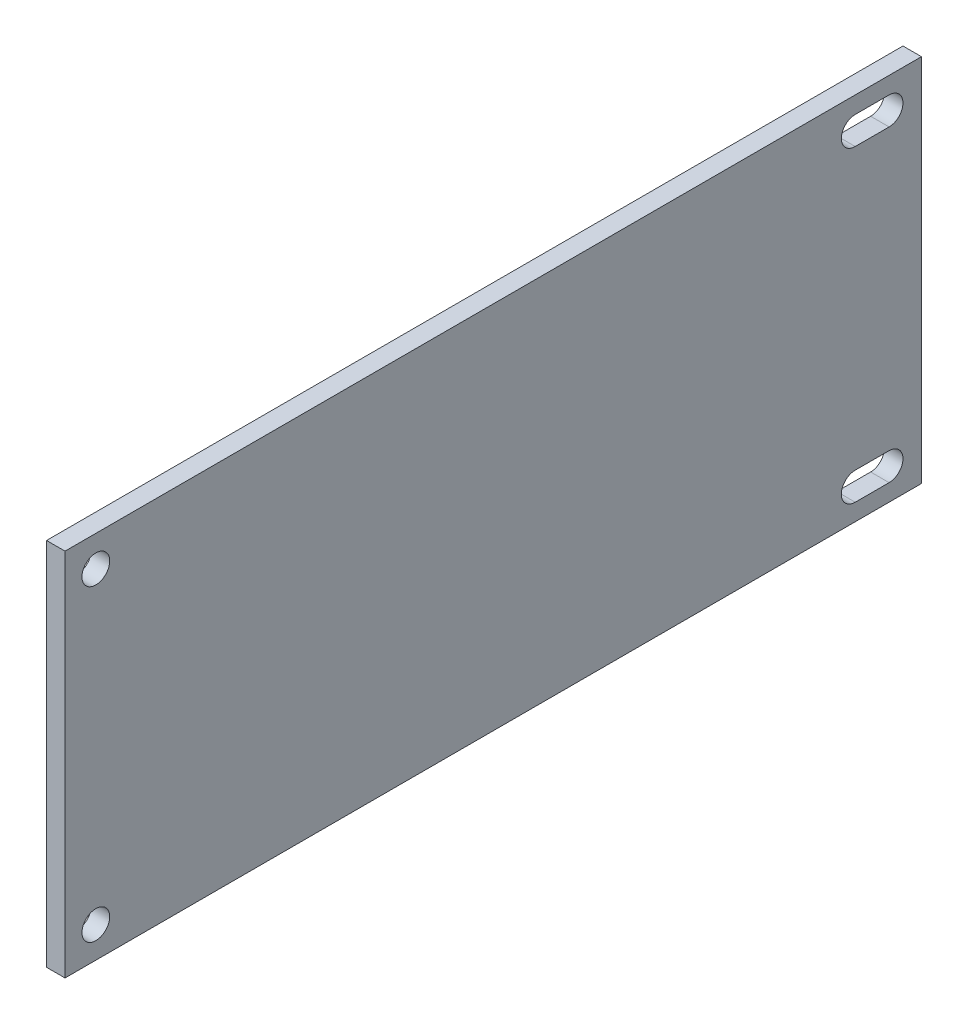
from build123d import *

# Parameters (mm, degrees)
SKETCH_1_W               = 139
SKETCH_1_H               = 60
EXTRUDE_1_DEPTH          = 1.5
HOLE_WIZARD_M4_1_D       = 4.5
HOLE_START               = -1.5
HOLE_WIZARD_M4_1_2_DEPTH = 3


# Read off the part's stored shape, not the designer's step: M4 间隙槽口1
with BuildPart() as part:
    # 草图1 → 凸台-拉伸1 (new, symmetric)
    with BuildSketch(Plane(origin=(0, 0, 0), x_dir=(0, 0, -1), z_dir=(1, 0, 0))):
        with Locations((69.5, 30)):
            Rectangle(SKETCH_1_W, SKETCH_1_H)
    extrude(amount=EXTRUDE_1_DEPTH, both=True)

    # Hole Wizard M4 _1 (through all)
    with Locations(Plane(origin=(1.5, 0, 0), x_dir=(0, 0, -1), z_dir=(1, 0, 0))):
        with Locations((5, 55), (5, 5)):
            Hole(HOLE_WIZARD_M4_1_D / 2)

    # Hole Wizard M4 _1 2 outline → Hole Wizard M4 _1 2 (cut)
    with BuildSketch(Plane.YZ.offset(HOLE_START)):
        with BuildLine():
            Line((7.25, -133.75), (7.25, -128.25))
            ThreePointArc((7.25, -128.25), (5, -126), (2.75, -128.25))
            Line((2.75, -128.25), (2.75, -133.75))
            ThreePointArc((2.75, -133.75), (5, -136), (7.25, -133.75))
        make_face()
        with BuildLine():
            Line((57.25, -133.75), (57.25, -128.25))
            ThreePointArc((57.25, -128.25), (55, -126), (52.75, -128.25))
            Line((52.75, -128.25), (52.75, -133.75))
            ThreePointArc((52.75, -133.75), (55, -136), (57.25, -133.75))
        make_face()
    extrude(amount=HOLE_WIZARD_M4_1_2_DEPTH, mode=Mode.SUBTRACT)


solid = part.part
